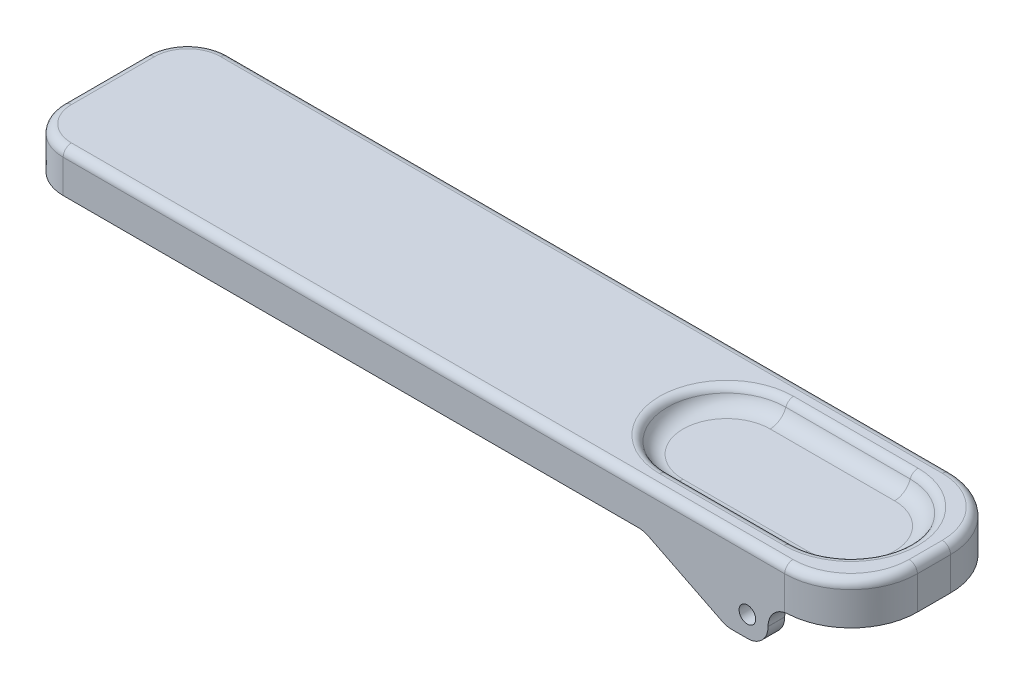
from build123d import *

# Parameters (mm, degrees)
BOSS_EXTRUDE1_DEPTH     = 5
CUT_EXTRUDE2_DEPTH      = 2
FILLET1_R               = 2
FILLET2_R               = 1
SKETCH8_W               = 18
SKETCH8_H               = 0.5
SKETCH8_W_2             = 16
CUT_EXTRUDE3_DEPTH      = 50
FILLET3_R               = 1
SKETCH9_W               = 20
SKETCH9_H               = 15
CUT_EXTRUDE4_DEPTH      = 1
SKETCH10_W              = 15
SKETCH10_H              = 2
BOSS_EXTRUDE2_DEPTH     = 5
FILLET4_R               = 2.49
CUT_EXTRUDE5_DEPTH      = 55.083269261
CUT_EXTRUDE5_DEPTH_BACK = 55.083269261
FILLET5_R               = 2.49
CUT_EXTRUDE6_DEPTH      = 55.083269261
CUT_EXTRUDE6_DEPTH_BACK = 55.083269261
SKETCH13_R              = 1


# Some blends are built 0.0001 mm under size
with BuildPart() as part:
    # Sketch2 → Boss-Extrude1 (new body)
    with BuildSketch(Plane(origin=(0, 0, 0), x_dir=(1, 0, 0), z_dir=(0, 1, 0))):
        with BuildLine():
            Line((-45, 10), (42, 10))
            ThreePointArc((42, 10), (47.656854249, 7.656854249), (50, 2))
            Line((50, 2), (50, -2))
            ThreePointArc((50, -2), (47.656854249, -7.656854249), (42, -10))
            Line((42, -10), (-45, -10))
            ThreePointArc((-45, -10), (-48.535533906, -8.535533906), (-50, -5))
            Line((-50, -5), (-50, 5))
            ThreePointArc((-50, 5), (-48.535533906, 8.535533906), (-45, 10))
        make_face()
    extrude(amount=BOSS_EXTRUDE1_DEPTH)

    # Sketch7 → Cut-Extrude2 (cut)
    with BuildSketch(Plane(origin=(0, 5, 0), x_dir=(1, 0, 0), z_dir=(0, 1, 0))):
        with BuildLine():
            Line((25, 7.25), (40, 7.25))
            ThreePointArc((40, 7.25), (47.25, 0), (40, -7.25))
            Line((40, -7.25), (25, -7.25))
            ThreePointArc((25, -7.25), (17.75, 0), (25, 7.25))
        make_face()
    extrude(amount=-CUT_EXTRUDE2_DEPTH, mode=Mode.SUBTRACT)

    # Fillet1
    fillet1_edges = [part.edges().sort_by_distance(p)[0] for p in [
        (32.5, 3, 7.25),
        (17.75, 3, 0),
        (47.25, 3, 0),
        (32.5, 3, -7.25),
    ]]
    fillet(fillet1_edges, radius=FILLET1_R - 0.0001)  # a hair under: the kernel refuses the full size

    # Fillet2
    # the kernel refuses this fillet: 1 mm, written as the material it takes off along each edge
    with BuildSketch(Plane(origin=(25, 5, 0), x_dir=(0, 0, 1), z_dir=(1, 0, 0))) as fillet2_piece_1:
        with BuildLine():
            CenterArc((8.078456413, 1), FILLET2_R, 199.469870121, 70.53012988)
            Line((8.078456413, 0), (8.078456413, -0.1))
            Line((8.078456413, -0.1), (7.25, -0.1))
            Line((7.25, -0.1), (7.15, 0))
            ThreePointArc((7.15, 0), (7.15, 0.0001), (7.041357825, 0.633357779))
            Line((7.041357825, 0.633357779), (7.135639515, 0.66668889))
        make_face()
    revolve(axis=Axis((25, 5, 0), (0, -1, 0)), revolution_arc=180, mode=Mode.SUBTRACT)
    with BuildSketch(Plane(origin=(40, 5, 7.25), x_dir=(0, 0, 1), z_dir=(-1, 0, 0))) as fillet2_piece_2:
        with BuildLine():
            CenterArc((0.828456413, -1), FILLET2_R, 90, 70.530129879)
            Line((-0.114360485, -0.66668889), (-0.208642175, -0.633357779))
            ThreePointArc((-0.208642175, -0.633357779), (-0.1, -0.0001), (-0.1, 0))
            Line((-0.1, 0), (0, 0.1))
            Line((0, 0.1), (0.828456413, 0.1))
            Line((0.828456413, 0.1), (0.828456413, 0))
        make_face()
    extrude(amount=15, mode=Mode.SUBTRACT)
    with BuildSketch(Plane(origin=(40, 5, 0), x_dir=(0, 0, -1), z_dir=(-1, 0, 0))) as fillet2_piece_3:
        with BuildLine():
            CenterArc((8.078456413, 1), FILLET2_R, 199.469870121, 70.530129879)
            Line((7.135639515, 0.66668889), (7.041357825, 0.633357779))
            ThreePointArc((7.041357825, 0.633357779), (7.15, 0.0001), (7.15, 0))
            Line((7.15, 0), (7.25, -0.1))
            Line((7.25, -0.1), (8.078456413, -0.1))
            Line((8.078456413, -0.1), (8.078456413, 0))
        make_face()
    revolve(axis=Axis((40, 5, 0), (0, -1, 0)), revolution_arc=180, mode=Mode.SUBTRACT)
    with BuildSketch(Plane(origin=(25, 5, -7.25), x_dir=(0, -0.9856047790757024, 0.16906572527610647), z_dir=(1, 0, 0))) as fillet2_piece_4:
        with BuildLine():
            CenterArc((0.845541195, 0.985596325), FILLET2_R, 189.733502803, 70.53012988)
            Line((-0.140063584, 0.8165306), (-0.238624062, 0.799624028))
            Line((-0.238624062, 0.799624028), (-0.098560478, -0.016906573))
            Line((-0.098560478, -0.016906573), (0.016906573, -0.098560478))
            ThreePointArc((0.016906573, -0.098560478), (0.017005133, -0.098543571), (0.659514694, -0.098559633))
            Line((0.659514694, -0.098559633), (0.676426194, 0))
        make_face()
    extrude(amount=15, mode=Mode.SUBTRACT)

    # Sketch8 → Cut-Extrude3 (cut)
    with BuildSketch(Plane.ZY.offset(50)):
        with Locations((0, 1.25)):
            Rectangle(SKETCH8_W, SKETCH8_H)
        with Locations((0, 0.75)):
            Rectangle(SKETCH8_W_2, SKETCH8_H)
    extrude(amount=-CUT_EXTRUDE3_DEPTH, mode=Mode.SUBTRACT)

    # Fillet3
    fillet3_edges = [part.edges().sort_by_distance(p)[0] for p in [
        (-48.535533906, 5, 8.535533906),
        (-1.5, 5, 10),
        (47.656854249, 5, 7.656854249),
        (50, 5, 0),
        (47.656854249, 5, -7.656854249),
        (-1.5, 5, -10),
        (-48.535533906, 5, -8.535533906),
        (-50, 5, 0),
    ]]
    fillet(fillet3_edges, radius=FILLET3_R)

    # Sketch9 → Cut-Extrude4 (cut)
    with BuildSketch(Plane.XZ):
        with Locations((-30, 0)):
            Rectangle(SKETCH9_W, SKETCH9_H)
    extrude(amount=-CUT_EXTRUDE4_DEPTH, mode=Mode.SUBTRACT)

    # Sketch10 → Boss-Extrude2 (add)
    with BuildSketch(Plane.XZ):
        with Locations((32.5, 9)):
            Rectangle(SKETCH10_W, SKETCH10_H)
        with Locations((32.5, -9)):
            Rectangle(SKETCH10_W, SKETCH10_H)
    extrude(amount=BOSS_EXTRUDE2_DEPTH)

    # Fillet4
    fillet4_edges = [part.edges().sort_by_distance(p)[0] for p in [
        (40, -5, -9),
        (40, 0, -9),
        (40, -5, 9),
        (40, 0, 9),
    ]]
    fillet(fillet4_edges, radius=FILLET4_R)

    # Sketch12 → Cut-Extrude5 (cut, two sides: drawn at the far end of the back side and taken through both)
    with BuildSketch(Plane.XY.offset(10).offset(-CUT_EXTRUDE5_DEPTH_BACK)):
        Polygon((25, 0), (35, -5), (35, -11.867947074), (25, -11.867947074), align=None)
    extrude(amount=CUT_EXTRUDE5_DEPTH + CUT_EXTRUDE5_DEPTH_BACK, mode=Mode.SUBTRACT)

    # Fillet5
    fillet5_edges = [part.edges().sort_by_distance(p)[0] for p in [
        (25, 0, 9),
        (25, 0, -9),
        (35, -5, -9),
        (35, -5, 9),
    ]]
    fillet(fillet5_edges, radius=FILLET5_R)

    # Sketch13 → Cut-Extrude6 (cut, two sides: drawn at the far end of the back side and taken through both)
    with BuildSketch(Plane(origin=(0, 0, -10), x_dir=(-1, 0, 0), z_dir=(0, 0, -1)).offset(-CUT_EXTRUDE6_DEPTH_BACK)):
        with Locations((-37.5, -2.5)):
            Circle(SKETCH13_R)
    extrude(amount=CUT_EXTRUDE6_DEPTH + CUT_EXTRUDE6_DEPTH_BACK, mode=Mode.SUBTRACT)


solid = part.part
